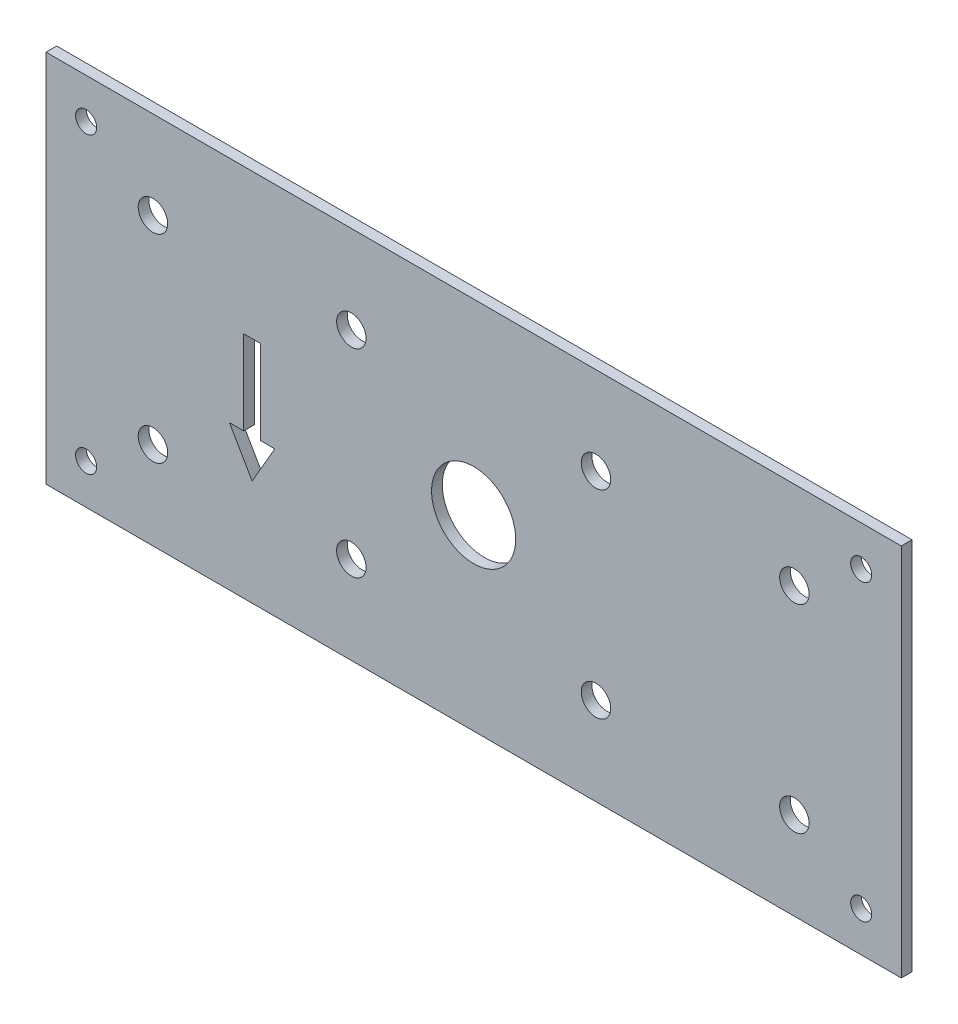
from build123d import *

# Parameters (mm, degrees)
SKETCH2_W               = 203.2
SKETCH2_H               = 88.9
SKETCH2_R               = 3.5
SKETCH2_R_2             = 10
BOSS_EXTRUDE1_DEPTH     = 1.27
SKETCH3_R               = 2.5
CUT_EXTRUDE1_DEPTH      = 111.92706658
CUT_EXTRUDE2_DEPTH      = 111.92706658
CUT_EXTRUDE2_DEPTH_BACK = 111.92706658


with BuildPart() as part:
    # Sketch2 → Boss-Extrude1 (new, symmetric)
    with BuildSketch(Plane.XY):
        Rectangle(SKETCH2_W, SKETCH2_H)
        with Locations((-76.2, 23.57)):
            Circle(SKETCH2_R, mode=Mode.SUBTRACT)
        with Locations((-29.06, 23.57)):
            Circle(SKETCH2_R, mode=Mode.SUBTRACT)
        with Locations((-29.06, -23.57)):
            Circle(SKETCH2_R, mode=Mode.SUBTRACT)
        with Locations((-76.2, -23.57)):
            Circle(SKETCH2_R, mode=Mode.SUBTRACT)
        with Locations((29.06, -23.57)):
            Circle(SKETCH2_R, mode=Mode.SUBTRACT)
        with Locations((76.2, -23.57)):
            Circle(SKETCH2_R, mode=Mode.SUBTRACT)
        with Locations((76.2, 23.57)):
            Circle(SKETCH2_R, mode=Mode.SUBTRACT)
        with Locations((29.06, 23.57)):
            Circle(SKETCH2_R, mode=Mode.SUBTRACT)
        Circle(SKETCH2_R_2, mode=Mode.SUBTRACT)
    extrude(amount=BOSS_EXTRUDE1_DEPTH, both=True)

    # Sketch3 → Cut-Extrude1 (cut, through all)
    with BuildSketch(Plane.XY.offset(1.27)):
        with Locations((-92.075, 34.925)):
            Circle(SKETCH3_R)
        with Locations((-92.075, -34.925)):
            Circle(SKETCH3_R)
        with Locations((92.075, -34.925)):
            Circle(SKETCH3_R)
        with Locations((92.075, 34.925)):
            Circle(SKETCH3_R)
    extrude(amount=-CUT_EXTRUDE1_DEPTH, mode=Mode.SUBTRACT)

    # Sketch4 → Cut-Extrude2 (cut, two sides: drawn at the far end of the back side and taken through both)
    with BuildSketch(Plane.XY.offset(1.27).offset(-CUT_EXTRUDE2_DEPTH_BACK)):
        Polygon((-47.251206088, -10), (-50.63, -10), (-50.63, 10), (-54.63, 10), (-54.63, -10), (-58.008793912, -10), (-52.63, -19.316344338), align=None)
    extrude(amount=CUT_EXTRUDE2_DEPTH + CUT_EXTRUDE2_DEPTH_BACK, mode=Mode.SUBTRACT)


solid = part.part
